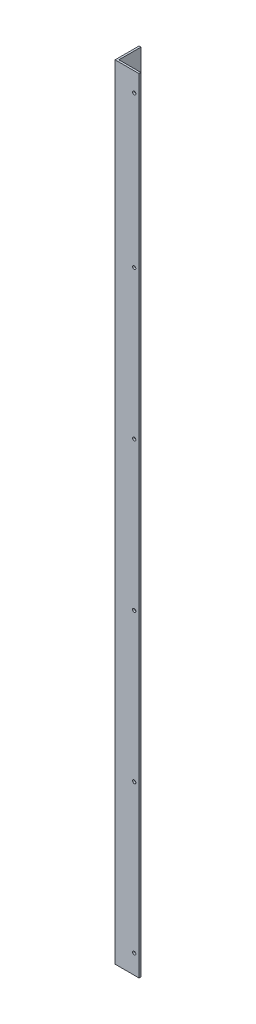
from build123d import *

# Parameters (mm, degrees)
ESTRUSIONE_ESTRUSIONE1_DEPTH = 819
SCHIZZO3_R                   = 1.7
TAGLIO_ESTRUSIONE1_DEPTH     = 820.762770562


with BuildPart() as part:
    # Schizzo2 → Estrusione-Estrusione1 (new body)
    with BuildSketch(Plane(origin=(0, 0, 0), x_dir=(1, 0, 0), z_dir=(0, 1, 0))):
        Polygon((0, 0), (25, 0), (25, 2), (2, 2), (2, 25), (0, 25), align=None)
    extrude(amount=ESTRUSIONE_ESTRUSIONE1_DEPTH)

    # Schizzo3 → Taglio-Estrusione1 (cut, through all)
    with BuildSketch(Plane.XY):
        with Locations((20, 20)):
            Circle(SCHIZZO3_R)
        with Locations((20, 330.4)):
            Circle(SCHIZZO3_R)
        with Locations((20, 485.6)):
            Circle(SCHIZZO3_R)
        with Locations((20, 175.2)):
            Circle(SCHIZZO3_R)
        with Locations((20, 640.8)):
            Circle(SCHIZZO3_R)
        with Locations((20, 799)):
            Circle(SCHIZZO3_R)
    extrude(amount=-TAGLIO_ESTRUSIONE1_DEPTH, mode=Mode.SUBTRACT)


solid = part.part
